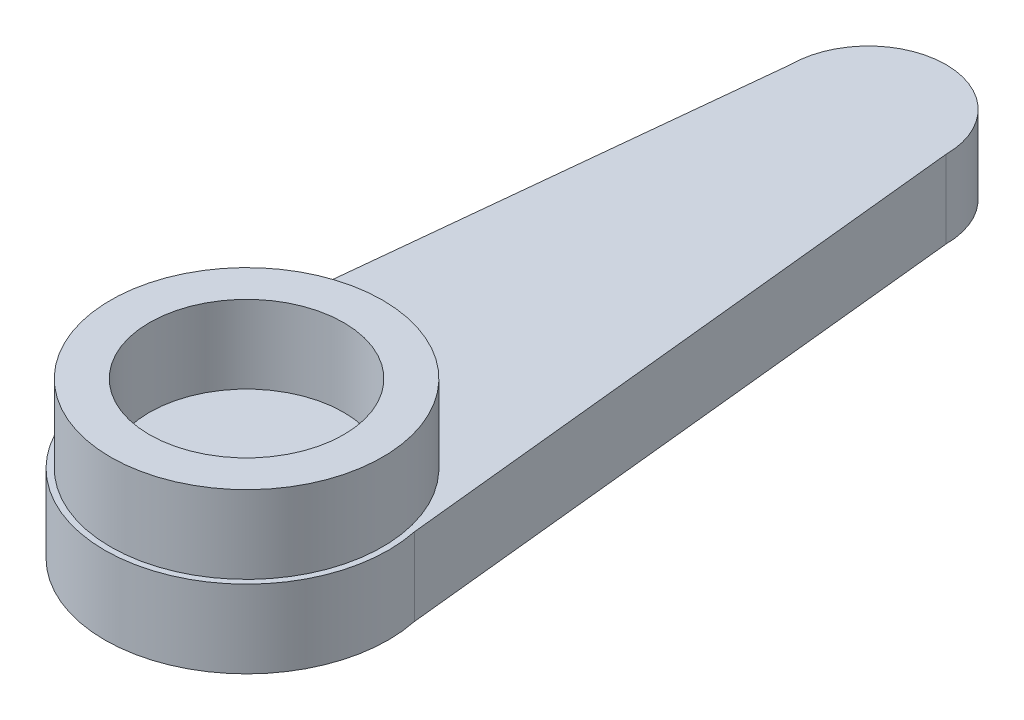
from build123d import *

# Parameters (mm, degrees)
BOSS_EXTRUDE1_DEPTH = 2
SKETCH2_R           = 3.5
BOSS_EXTRUDE2_DEPTH = 2
SKETCH3_R           = 2.5
CUT_EXTRUDE1_DEPTH  = 2


with BuildPart() as part:
    # Sketch1 → Boss-Extrude1 (new body)
    with BuildSketch(Plane(origin=(0, 0, 0), x_dir=(1, 0, 0), z_dir=(0, 1, 0))):
        with BuildLine():
            Line((-3.57318314, -7.255109239), (-2, 8))
            ThreePointArc((-2, 8), (0, 10), (2, 8))
            Line((2, 8), (3.57318314, -7.255109239))
            ThreePointArc((3.57318314, -7.255109239), (0, -11.65), (-3.57318314, -7.255109239))
        make_face()
    extrude(amount=-BOSS_EXTRUDE1_DEPTH)

    # Sketch2 → Boss-Extrude2 (add)
    with BuildSketch(Plane(origin=(0, 0, 0), x_dir=(1, 0, 0), z_dir=(0, 1, 0))):
        with Locations((0, -8)):
            Circle(SKETCH2_R)
    extrude(amount=BOSS_EXTRUDE2_DEPTH)

    # Sketch3 → Cut-Extrude1 (cut)
    with BuildSketch(Plane(origin=(0, 2, 0), x_dir=(1, 0, 0), z_dir=(0, 1, 0))):
        with Locations((0, -8)):
            Circle(SKETCH3_R)
    extrude(amount=-CUT_EXTRUDE1_DEPTH, mode=Mode.SUBTRACT)


solid = part.part
